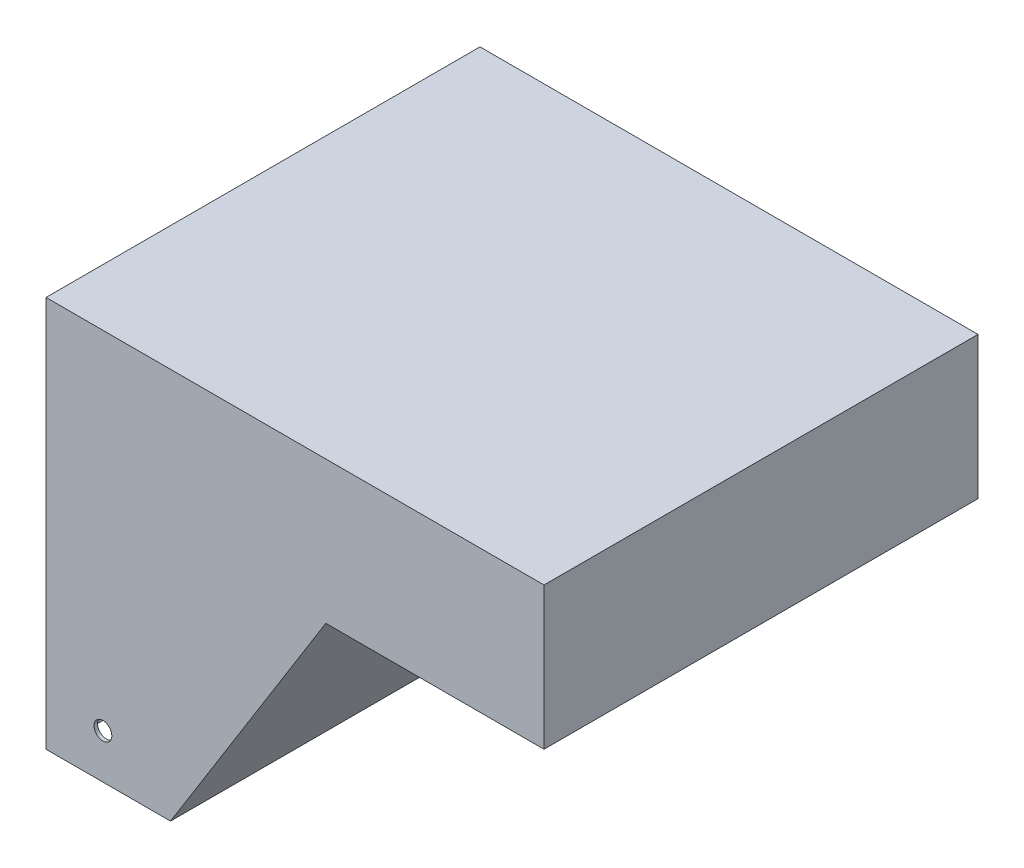
from build123d import *

# Parameters (mm, degrees)
SKETCH2_R           = 6.35
BOSS_EXTRUDE1_DEPTH = 2.54
BOSS_EXTRUDE2_DEPTH = 304.8
CUT_EXTRUDE1_REACH  = 550.217
SKETCH4_R           = 1.5875


with BuildPart() as part:
    # Sketch2 → Boss-Extrude1 (new body)
    with BuildSketch(Plane.XY):
        Polygon((0, 0), (355.6, 0), (355.6, -101.6), (199.80781759, -101.6), (88.9, -279.4), (0, -279.4), align=None)
        with Locations((40.64, -247.65)):
            Circle(SKETCH2_R, mode=Mode.SUBTRACT)
    boss_extrude1 = extrude(amount=BOSS_EXTRUDE1_DEPTH)

    # Sketch3 → Boss-Extrude2 (add)
    with BuildSketch(Plane.XY.offset(2.54)):
        Polygon((2.54, -279.4), (2.54, -276.86), (2.54, -2.54), (353.06, -2.54), (353.06, -99.06), (198.398569196, -99.06), (87.490751606, -276.86), (87.490751606, -279.4), (88.9, -279.4), (199.80781759, -101.6), (355.6, -101.6), (355.6, 0), (0, 0), (0, -279.4), align=None)
    extrude(amount=BOSS_EXTRUDE2_DEPTH)

    # Mirror1: Boss-Extrude1 across plane
    add(boss_extrude1.mirror(Plane.XY.offset(154.94)))

    # Sketch4 → Cut-Extrude1 (cut, up to next)
    with BuildSketch(Plane.ZY, mode=Mode.PRIVATE) as cut_extrude1_sk1:
        with Locations((120.015, -244.851012913)):
            Circle(SKETCH4_R)
    cut_extrude1_tool1 = extrude(cut_extrude1_sk1.sketch, amount=-CUT_EXTRUDE1_REACH, mode=Mode.PRIVATE) & part.part
    # Sketch4 → Cut-Extrude1 (cut, up to next)
    with BuildSketch(Plane.ZY, mode=Mode.PRIVATE) as cut_extrude1_sk2:
        with Locations((120.015, -270.251012913)):
            Circle(SKETCH4_R)
    cut_extrude1_tool2 = extrude(cut_extrude1_sk2.sketch, amount=-CUT_EXTRUDE1_REACH, mode=Mode.PRIVATE) & part.part
    # Sketch4 → Cut-Extrude1 (cut, up to next)
    with BuildSketch(Plane.ZY, mode=Mode.PRIVATE) as cut_extrude1_sk3:
        with Locations((189.865, -244.851012913)):
            Circle(SKETCH4_R)
    cut_extrude1_tool3 = extrude(cut_extrude1_sk3.sketch, amount=-CUT_EXTRUDE1_REACH, mode=Mode.PRIVATE) & part.part
    # Sketch4 → Cut-Extrude1 (cut, up to next)
    with BuildSketch(Plane.ZY, mode=Mode.PRIVATE) as cut_extrude1_sk4:
        with Locations((189.865, -270.251012913)):
            Circle(SKETCH4_R)
    cut_extrude1_tool4 = extrude(cut_extrude1_sk4.sketch, amount=-CUT_EXTRUDE1_REACH, mode=Mode.PRIVATE) & part.part
    add(cut_extrude1_tool1.solids().sort_by_distance((0, -244.851013, 120.015))[0], mode=Mode.SUBTRACT)
    add(cut_extrude1_tool2.solids().sort_by_distance((0, -270.251013, 120.015))[0], mode=Mode.SUBTRACT)
    add(cut_extrude1_tool3.solids().sort_by_distance((0, -244.851013, 189.865))[0], mode=Mode.SUBTRACT)
    add(cut_extrude1_tool4.solids().sort_by_distance((0, -270.251013, 189.865))[0], mode=Mode.SUBTRACT)


solid = part.part
